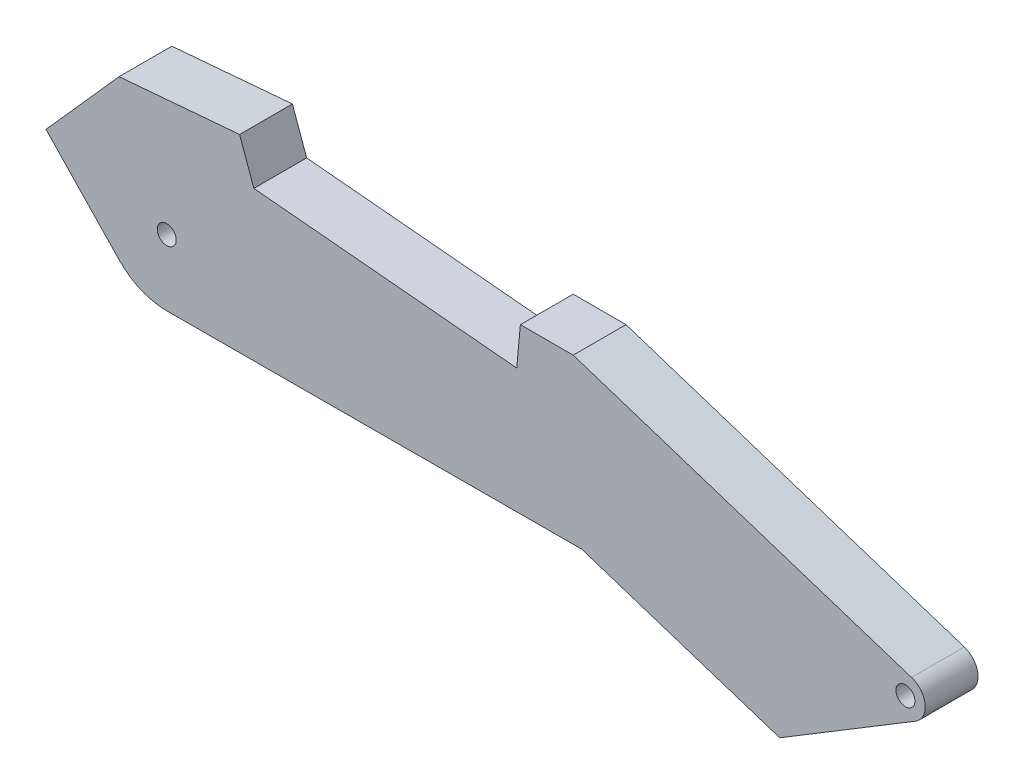
from build123d import *

# Parameters (mm, degrees)
SKETCH1_R           = 2.286
BOSS_EXTRUDE1_DEPTH = 12.7


with BuildPart() as part:
    # Sketch1 → Boss-Extrude1 (new body)
    with BuildSketch(Plane.XY):
        with BuildLine():
            Line((2.468332475, -4.072927822), (-30.234167525, -23.891752587))
            Line((-30.234167525, -23.891752587), (-77.859167525, -8.411978471))
            Line((-77.859167525, -8.411978471), (-177.612659542, -8.671992922))
            ThreePointArc((-177.612659542, -8.671992922), (-183.874691242, -7.402494702), (-189.129023253, -3.767021986))
            Line((-189.129023253, -3.767021986), (-206.6925, 14.605))
            Line((-206.6925, 14.605), (-189.129023253, 34.361632074))
            Line((-189.129023253, 34.361632074), (-160.12790345, 36.83))
            Line((-160.12790345, 36.83), (-156.708195198, 27.305))
            Line((-156.708195198, 27.305), (-93.474645084, 21.49396395))
            Line((-93.474645084, 21.49396395), (-92.602989677, 30.978996467))
            Line((-92.602989677, 30.978996467), (-79.902989677, 30.978996467))
            Line((-79.902989677, 30.978996467), (1.472164271, 4.529253648))
            ThreePointArc((1.472164271, 4.529253648), (4.730883656, 0.547855901), (2.468332475, -4.072927822))
        make_face()
        Circle(SKETCH1_R, mode=Mode.SUBTRACT)
        with Locations((-177.654038699, 7.20295315)):
            Circle(SKETCH1_R, mode=Mode.SUBTRACT)
    extrude(amount=BOSS_EXTRUDE1_DEPTH)


solid = part.part
